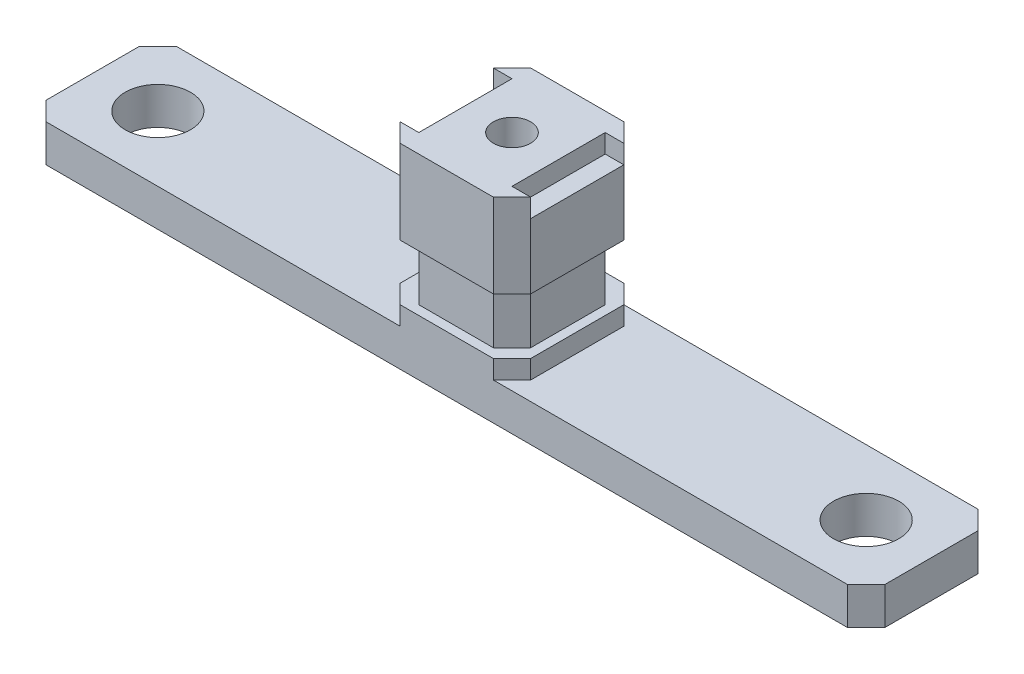
from build123d import *

# Parameters (mm, degrees)
SKETCH_1_W               = 90
SKETCH_1_H               = 14
EXTRUDE_1_DEPTH          = 4
CHAMFER_1_SIZE           = 2
SKETCH_2_W               = 14
SKETCH_2_H               = 14
EXTRUDE_2_DEPTH          = 17
CUT_EXTRUDE_START        = 2
SKETCH_3_OUTSIDE_W       = 110.694
SKETCH_3_OUTSIDE_H       = 34.694
SKETCH_3_OUTSIDE_W_2     = 12
SKETCH_3_OUTSIDE_H_2     = 12
CUT_EXTRUDE_1_DEPTH      = 6
CHAMFER_2_SIZE           = 2
SKETCH_4_W               = 2
SKETCH_4_H               = 10
EXTRUDE_3_DEPTH          = 2
CUT_EXTRUDE_2_DEPTH      = 51.149775672
CUT_EXTRUDE_2_DEPTH_BACK = 51.149775672
SKETCH_5_R               = 2
CUT_EXTRUDE_3_DEPTH      = 52.019604075
CUT_EXTRUDE_3_DEPTH_BACK = 12
SKETCH_6_R               = 4
CHAMFER_3_SIZE           = 2
SKETCH_7_R               = 3.5
CUT_EXTRUDE_4_DEPTH      = 50.345719166
CUT_EXTRUDE_5_DEPTH      = 52.019604075
CUT_EXTRUDE_5_DEPTH_BACK = 4
SKETCH_8_W               = 2
SKETCH_8_H               = 10


with BuildPart() as part:
    # 草图1 → 凸台-拉伸1 (new body)
    with BuildSketch(Plane(origin=(0, 0, 0), x_dir=(1, 0, 0), z_dir=(0, 1, 0))):
        Rectangle(SKETCH_1_W, SKETCH_1_H)
    extrude(amount=EXTRUDE_1_DEPTH)

    # 倒角1
    chamfer_1_edges = [part.edges().sort_by_distance(p)[0] for p in [
        (45, 2, 7),
        (-45, 2, 7),
        (-45, 2, -7),
        (45, 2, -7),
    ]]
    chamfer(chamfer_1_edges, length=CHAMFER_1_SIZE)

    # 草图2 → 凸台-拉伸2 (add)
    with BuildSketch(Plane(origin=(0, 4, 0), x_dir=(1, 0, 0), z_dir=(0, 1, 0))):
        Rectangle(SKETCH_2_W, SKETCH_2_H)
    extrude(amount=EXTRUDE_2_DEPTH)

    # 草图3 outside → 切除-拉伸1 (cut)
    with BuildSketch(Plane(origin=(0, 4, 0), x_dir=(1, 0, 0), z_dir=(0, 1, 0)).offset(CUT_EXTRUDE_START)):
        Rectangle(SKETCH_3_OUTSIDE_W, SKETCH_3_OUTSIDE_H)
        Rectangle(SKETCH_3_OUTSIDE_W_2, SKETCH_3_OUTSIDE_H_2, mode=Mode.SUBTRACT)
    extrude(amount=CUT_EXTRUDE_1_DEPTH, mode=Mode.SUBTRACT)

    # 倒角2
    chamfer_2_edges = [part.edges().sort_by_distance(p)[0] for p in [
        (7, 16.5, 7),
        (7, 16.5, -7),
        (-7, 16.5, -7),
        (-7, 16.5, 7),
        (-7, 5, 7),
        (-7, 5, -7),
        (7, 5, -7),
        (7, 5, 7),
        (6, 9, -6),
        (-6, 9, -6),
        (-6, 9, 6),
        (6, 9, 6),
    ]]
    chamfer(chamfer_2_edges, length=CHAMFER_2_SIZE)

    # 草图4 → 凸台-拉伸3 (add)
    with BuildSketch(Plane(origin=(0, 21, 0), x_dir=(1, 0, 0), z_dir=(0, 1, 0))):
        with Locations((-6, 0)):
            Rectangle(SKETCH_4_W, SKETCH_4_H)
    extrude_3 = extrude(amount=EXTRUDE_3_DEPTH)

    # 镜向1: 凸台-拉伸3 across plane
    add(extrude_3.mirror(Plane(origin=(0, 0, 0), x_dir=(0, 0, 1), z_dir=(1, 0, 0))))

    # 草图5 → 切除-拉伸2 (cut, two sides: drawn at the far end of the back side and taken through both)
    with BuildSketch(Plane(origin=(0, 21, 0), x_dir=(1, 0, 0), z_dir=(0, 1, 0)).offset(-CUT_EXTRUDE_2_DEPTH_BACK)):
        with Locations(Location((0, 0, 0), (0, 0, 270))):
            Circle(SKETCH_5_R)
    extrude(amount=CUT_EXTRUDE_2_DEPTH + CUT_EXTRUDE_2_DEPTH_BACK, mode=Mode.SUBTRACT)

    # 草图6 → 切除-拉伸3 (cut, two sides: drawn at the far end of the back side and taken through both)
    with BuildSketch(Plane.XZ.offset(-CUT_EXTRUDE_3_DEPTH_BACK)):
        with Locations(Location((0, 0, 0), (0, 0, 270))):
            Circle(SKETCH_6_R)
    extrude(amount=CUT_EXTRUDE_3_DEPTH + CUT_EXTRUDE_3_DEPTH_BACK, mode=Mode.SUBTRACT)

    # 倒角3
    chamfer_3_edges = [part.edges().sort_by_distance(p)[0] for p in [
        (0, 12, -2),
    ]]
    chamfer(chamfer_3_edges, length=CHAMFER_3_SIZE - 0.0001)  # a hair under: the kernel refuses the full size

    # 草图7 → 切除-拉伸4 (cut, symmetric)
    with BuildSketch(Plane(origin=(0, 4, 0), x_dir=(1, 0, 0), z_dir=(0, 1, 0))):
        with Locations(Location((-38, 0, 0), (0, 0, 270))):
            Circle(SKETCH_7_R)
    cut_extrude_4 = extrude(amount=CUT_EXTRUDE_4_DEPTH, both=True, mode=Mode.SUBTRACT)

    # 镜向2: 切除-拉伸4 across plane
    add(cut_extrude_4.mirror(Plane(origin=(0, 0, 0), x_dir=(0, 0, 1), z_dir=(1, 0, 0))), mode=Mode.SUBTRACT)

    # 草图8 → 切除-拉伸5 (cut, two sides: drawn at the far end of the back side and taken through both)
    with BuildSketch(Plane(origin=(0, 23, 0), x_dir=(1, 0, 0), z_dir=(0, 1, 0)).offset(-CUT_EXTRUDE_5_DEPTH_BACK)):
        with Locations((6, 0)):
            Rectangle(SKETCH_8_W, SKETCH_8_H)
        with Locations((-6, 0)):
            Rectangle(SKETCH_8_W, SKETCH_8_H)
    extrude(amount=CUT_EXTRUDE_5_DEPTH + CUT_EXTRUDE_5_DEPTH_BACK, mode=Mode.SUBTRACT)


solid = part.part
